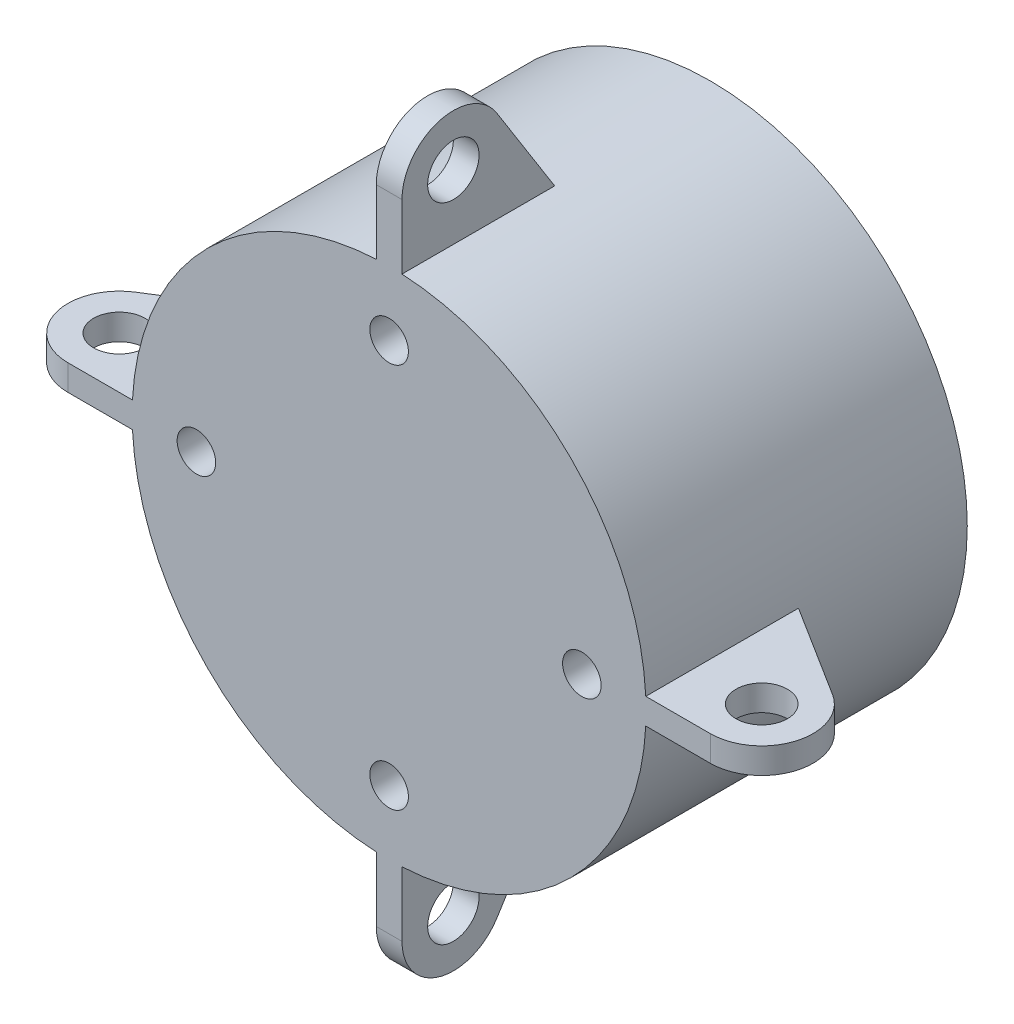
from build123d import *

# Parameters (mm, degrees)
SKETCH_1_R               = 40
EXTRUDE_1_DEPTH          = 50
SKETCH_2_R               = 3
CUT_EXTRUDE_1_DEPTH      = 10
SKETCH_3_R               = 4
EXTRUDE_2_DEPTH          = 2
PATTERN_CIRCULAR_1_COUNT = 4


with BuildPart() as part:
    # 草图1 → 凸台-拉伸1 (new body)
    with BuildSketch(Plane.XY):
        Circle(SKETCH_1_R)
    extrude(amount=-EXTRUDE_1_DEPTH)

    # 草图2 → 切除-拉伸1 (cut)
    with BuildSketch(Plane.XY):
        with Locations((0, 30)):
            Circle(SKETCH_2_R)
        with Locations((30, 0)):
            Circle(SKETCH_2_R)
        with Locations((0, -30)):
            Circle(SKETCH_2_R)
        with Locations((-30, 0)):
            Circle(SKETCH_2_R)
    extrude(amount=-CUT_EXTRUDE_1_DEPTH, mode=Mode.SUBTRACT)

    # 草图3 → 凸台-拉伸2 (add, symmetric)
    with BuildSketch(Plane(origin=(0, 0, 0), x_dir=(0, 0, -1), z_dir=(1, 0, 0))):
        with BuildLine():
            Line((25, 38), (0, 38))
            Line((0, 38), (0, 50))
            ThreePointArc((0, 50), (5.783329548, 57.686766037), (14.771593026, 54.259756787))
            Line((14.771593026, 54.259756787), (25, 38))
        make_face()
        with Locations((8, 50)):
            Circle(SKETCH_3_R, mode=Mode.SUBTRACT)
    extrude_2 = extrude(amount=EXTRUDE_2_DEPTH, both=True)

    # 阵列(圆周)1: 凸台-拉伸2 ×4 about axis
    pattern_circular_1_axis = Axis((0, 0, -50), (0, 0, 1))
    for i in range(1, PATTERN_CIRCULAR_1_COUNT):
        add(extrude_2.rotate(pattern_circular_1_axis, i * 360 / PATTERN_CIRCULAR_1_COUNT))


solid = part.part
